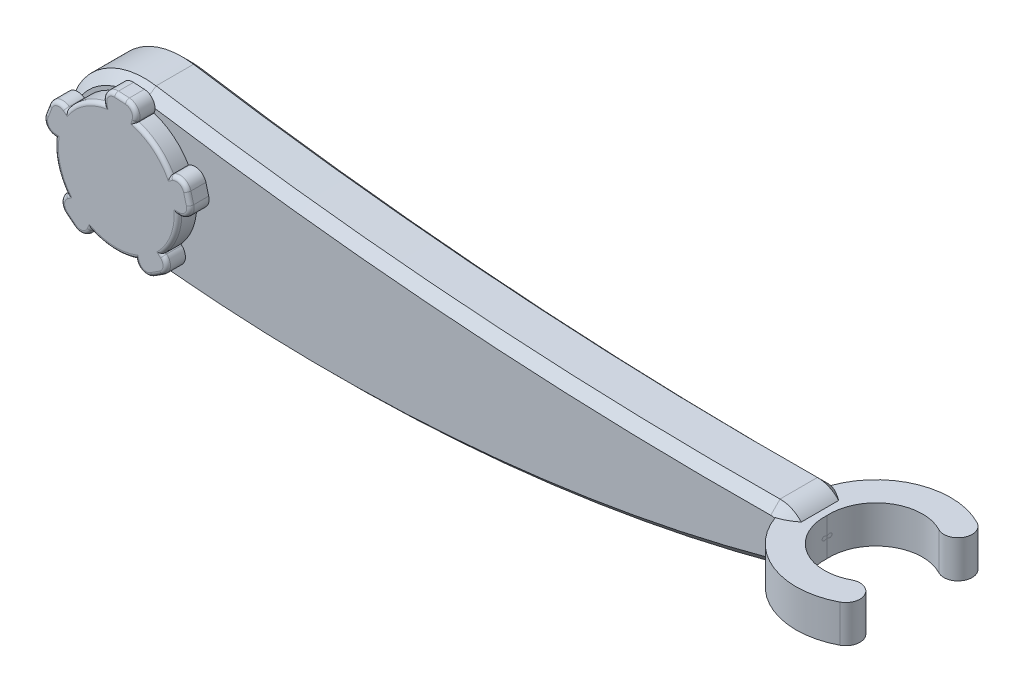
from build123d import *

# Parameters (mm, degrees)
BOSS_EXTRUDE1_DEPTH = 7.5
CHAMFER1_SIZE       = 2.5
SKETCH2_R           = 16.5
BOSS_EXTRUDE2_DEPTH = 5
BOSS_EXTRUDE3_DEPTH = 5
FILLET1_R           = 1
SKETCH5_R           = 5
BOSS_EXTRUDE4_DEPTH = 10
BOSS_EXTRUDE5_DEPTH = 5


with BuildPart() as part:
    # Sketch1 → Boss-Extrude1 (new, symmetric)
    with BuildSketch(Plane.XY):
        with BuildLine():
            ThreePointArc((84.922137279, 7.499595816), (1.268561005, 10.133701432), (-81.871756055, 19.753837344))
            ThreePointArc((-81.871756055, 19.753837344), (-104.805956297, 2.779225641), (-87.429342093, -19.851909152))
            ThreePointArc((-87.429342093, -19.851909152), (-0.615960999, -22.033786419), (85, -7.5))
            ThreePointArc((85, -7.5), (92.499898953, 0.038931885), (84.922137279, 7.499595816))
        make_face()
    extrude(amount=BOSS_EXTRUDE1_DEPTH, both=True)

    # Chamfer1
    chamfer1_edges = [part.edges().sort_by_distance(p)[0] for p in [
        (92.499898953, 0.038931885, -7.5),
        (1.268561005, 10.133701432, -7.5),
        (-104.805956297, 2.779225641, -7.5),
        (-0.615960999, -22.033786419, -7.5),
        (-104.805956297, 2.779225641, 7.5),
        (1.268561005, 10.133701432, 7.5),
        (92.499898953, 0.038931885, 7.5),
        (-0.615960999, -22.033786419, 7.5),
    ]]
    chamfer(chamfer1_edges, length=CHAMFER1_SIZE)

    # Sketch2 → Boss-Extrude2 (add)
    with BuildSketch(Plane.XY.offset(7.5)):
        with Locations((-85, 0)):
            Circle(SKETCH2_R)
    extrude(amount=BOSS_EXTRUDE2_DEPTH)

    # Sketch3 → Boss-Extrude3 (add)
    with BuildSketch(Plane.XY.offset(12.5)):
        with BuildLine():
            Line((-83, 0), (-68.20415251, 0))
            ThreePointArc((-68.20415251, 0), (-65.824092489, 1.173715713), (-65.306375031, 3.776457135))
            Line((-65.306375031, 3.776457135), (-66.056591917, 6.576304669))
            ThreePointArc((-66.056591917, 6.576304669), (-67.806319099, 8.571486131), (-70.454369396, 8.397923745))
            Line((-70.454369396, 8.397923745), (-83.267949192, 1))
            ThreePointArc((-83.267949192, 1), (-83.068148347, 0.51763809), (-83, 0))
        make_face()
        with BuildLine():
            ThreePointArc((-83.513710349, -1.338261213), (-83.91072193, -1.677341136), (-84.381966011, -1.902113033))
            Line((-84.381966011, -1.902113033), (-79.809797691, -15.973800202))
            ThreePointArc((-79.809797691, -15.973800202), (-77.95804872, -17.874673692), (-75.322711037, -17.562760922))
            Line((-75.322711037, -17.562760922), (-72.891727563, -15.984061795))
            ThreePointArc((-72.891727563, -15.984061795), (-71.534892666, -13.703427379), (-72.518252849, -11.238615615))
            Line((-72.518252849, -11.238615615), (-83.513710349, -1.338261213))
        make_face()
        with BuildLine():
            ThreePointArc((-85.813473286, -1.827090915), (-86.258640782, -1.554291923), (-86.618033989, -1.175570505))
            Line((-86.618033989, -1.175570505), (-98.588126054, -9.872351454))
            ThreePointArc((-98.588126054, -9.872351454), (-99.823742272, -12.220871592), (-98.71273147, -14.630840322))
            Line((-98.71273147, -14.630840322), (-96.460084172, -16.454998137))
            ThreePointArc((-96.460084172, -16.454998137), (-93.871786907, -17.040670013), (-91.831486626, -15.343770181))
            Line((-91.831486626, -15.343770181), (-85.813473286, -1.827090915))
        make_face()
        with BuildLine():
            ThreePointArc((-86.989043791, 0.209056927), (-86.867160853, 0.716735899), (-86.618033989, 1.175570505))
            Line((-86.618033989, 1.175570505), (-98.588126054, 9.872351454))
            ThreePointArc((-98.588126054, 9.872351454), (-101.203527845, 10.321759676), (-103.15222309, 8.52040432))
            Line((-103.15222309, 8.52040432), (-104.190993969, 5.814313662))
            ThreePointArc((-104.190993969, 5.814313662), (-103.948173183, 3.171714119), (-101.70383808, 1.755644127))
            Line((-101.70383808, 1.755644127), (-86.989043791, 0.209056927))
        make_face()
        with BuildLine():
            ThreePointArc((-85.415823382, 1.956295201), (-84.895328088, 1.99725907), (-84.381966011, 1.902113033))
            Line((-84.381966011, 1.902113033), (-79.809797691, 15.973800202))
            ThreePointArc((-79.809797691, 15.973800202), (-80.190588674, 18.600069896), (-82.505959371, 19.896739789))
            Line((-82.505959371, 19.896739789), (-85.400602379, 20.048441601))
            ThreePointArc((-85.400602379, 20.048441601), (-87.838828145, 19.000897142), (-88.49205305, 16.428817924))
            Line((-88.49205305, 16.428817924), (-85.415823382, 1.956295201))
        make_face()
    extrude(amount=-BOSS_EXTRUDE3_DEPTH)

    # Fillet1
    fillet1_edges = [part.edges().sort_by_distance(p)[0] for p in [
        (-88.461297974, 16.284126668, 12.5),
        (-87.838828145, 19.000897142, 12.5),
        (-83.953280875, 19.972590695, 12.5),
        (-80.190588674, 18.600069896, 12.5),
        (-79.855508642, 15.83311636, 12.5),
        (-74.616213548, 12.822908364, 12.5),
        (-70.582475117, 8.323961872, 12.5),
        (-67.806319099, 8.571486131, 12.5),
        (-65.681483474, 5.176380902, 12.5),
        (-65.824092489, 1.173715713, 12.5),
        (-68.352076255, 0, 12.5),
        (-69.595922963, -5.913071167, 12.5),
        (-72.628181614, -11.13963531, 12.5),
        (-71.534892666, -13.703427379, 12.5),
        (-74.1072193, -16.773411359, 12.5),
        (-77.95804872, -17.874673692, 12.5),
        (-79.855508642, -15.83311636, 12.5),
        (-85.863543278, -16.477387323, 12.5),
        (-91.771320618, -15.208635116, 12.5),
        (-93.871786907, -17.040670013, 12.5),
        (-97.586407821, -15.542919229, 12.5),
        (-99.823742272, -12.220871592, 12.5),
        (-98.468453231, -9.785404059, 12.5),
        (-100.937776134, -4.270514244, 12.5),
        (-101.556724677, 1.740181886, 12.5),
        (-103.948173183, 3.171714119, 12.5),
        (-103.67160853, 7.167358991, 12.5),
        (-101.203527845, 10.321759676, 12.5),
        (-98.468453231, 9.785404059, 12.5),
        (-93.986544078, 13.838064371, 12.5),
    ]]
    fillet(fillet1_edges, radius=FILLET1_R)

    # Sketch5 → Boss-Extrude4 (add)
    with BuildSketch(Plane(origin=(0, 0, -7.5), x_dir=(-1, 0, 0), z_dir=(0, 0, -1))):
        with Locations((85, 0)):
            Circle(SKETCH5_R)
    extrude(amount=BOSS_EXTRUDE4_DEPTH)


with BuildPart() as boss_extrude5_tool:
    # Sketch7 → Boss-Extrude5 (new, symmetric)
    with BuildSketch(Plane(origin=(0, 0, 0), x_dir=(1, 0, 0), z_dir=(0, 1, 0))):
        with BuildLine():
            ThreePointArc((84.922137279, 0), (94.310174815, 17.630690371), (114.271785043, 18.345259351))
            ThreePointArc((114.271785043, 18.345259351), (115.845259351, 13.228214957), (110.728214957, 11.654740649))
            ThreePointArc((110.728214957, 11.654740649), (98.215582654, 11.14272164), (92.5, 0))
            ThreePointArc((92.5, 0), (98.215582654, -11.14272164), (110.728214957, -11.654740649))
            ThreePointArc((110.728214957, -11.654740649), (115.845259351, -13.228214957), (114.271785043, -18.345259351))
            ThreePointArc((114.271785043, -18.345259351), (94.310174815, -17.630690371), (84.922137279, 0))
        make_face()
    extrude(amount=BOSS_EXTRUDE5_DEPTH, both=True)


with BuildPart() as part_1:
    add(part.part)


with BuildPart() as part_2:
    # Boss-Extrude5: joined with boss_extrude5_tool
    add(part_1.part.fuse(boss_extrude5_tool.part, tol=0.00001))


solid = part_2.part
